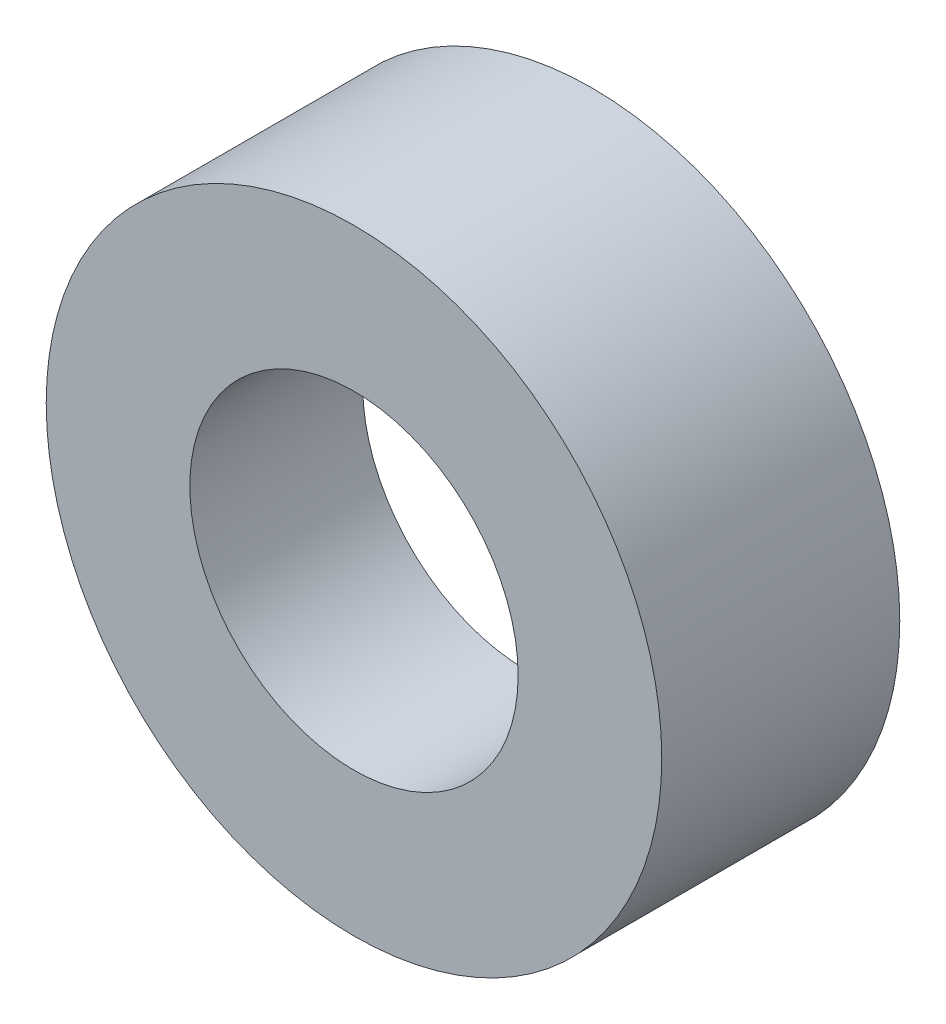
from build123d import *

# Parameters (mm, degrees)
SKETCH1_R           = 7.5
BOSS_EXTRUDE1_DEPTH = 5.8
SKETCH2_R           = 4
CUT_EXTRUDE1_DEPTH  = 94.348604063
SKETCH3_R           = 6.3
CUT_EXTRUDE2_DEPTH  = 1.5875


with BuildPart() as part:
    # Sketch1 → Boss-Extrude1 (new body)
    with BuildSketch(Plane.XY):
        with Locations((85.206527413, -1.763997815)):
            Circle(SKETCH1_R)
    extrude(amount=BOSS_EXTRUDE1_DEPTH)

    # Sketch2 → Cut-Extrude1 (cut, through all)
    with BuildSketch(Plane.XY.offset(5.8)):
        with Locations((85.206527413, -1.763997815)):
            Circle(SKETCH2_R)
    extrude(amount=-CUT_EXTRUDE1_DEPTH, mode=Mode.SUBTRACT)

    # Sketch3 → Cut-Extrude2 (cut)
    with BuildSketch(Plane(origin=(0, 0, 0), x_dir=(-1, 0, 0), z_dir=(0, 0, -1))):
        with Locations((-85.206527413, -1.763997815)):
            Circle(SKETCH3_R)
    extrude(amount=-CUT_EXTRUDE2_DEPTH, mode=Mode.SUBTRACT)


solid = part.part
